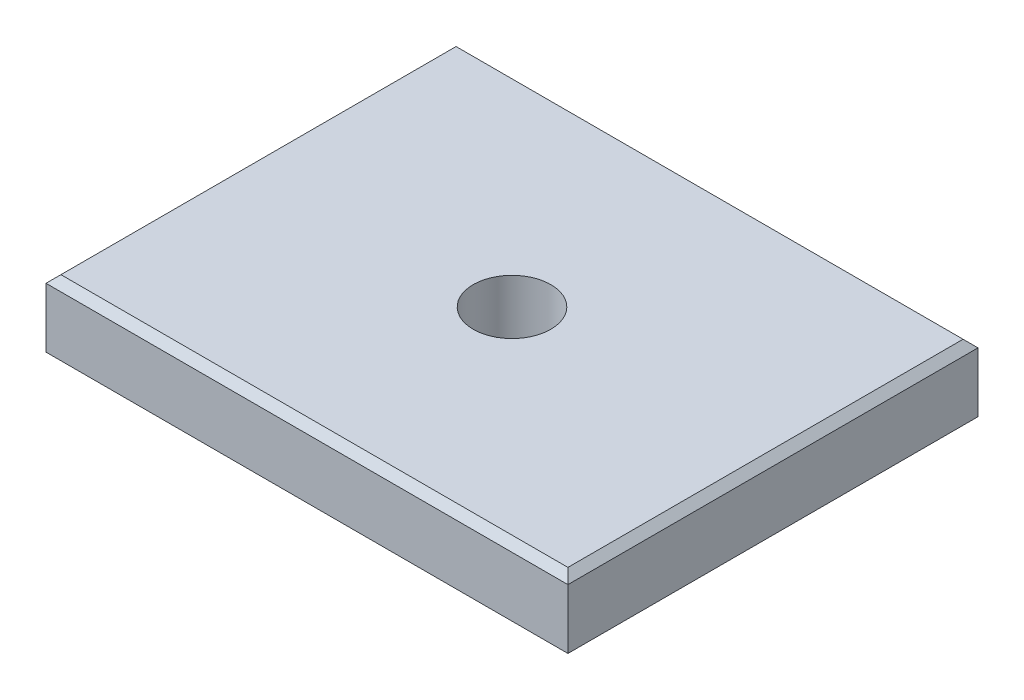
from build123d import *

# Parameters (mm, degrees)
SKETCH1_W           = 70
SKETCH1_H           = 55
BOSS_EXTRUDE1_DEPTH = 10
CHAMFER1_SIZE       = 1
SKETCH2_R           = 5.2
CUT_EXTRUDE1_DEPTH  = 46.620718977


with BuildPart() as part:
    # Sketch1 → Boss-Extrude1 (new body)
    with BuildSketch(Plane(origin=(0, 0, 0), x_dir=(1, 0, 0), z_dir=(0, 1, 0))):
        Rectangle(SKETCH1_W, SKETCH1_H)
    extrude(amount=-BOSS_EXTRUDE1_DEPTH)

    # Chamfer1
    chamfer1_edges = [part.edges().sort_by_distance(p)[0] for p in [
        (0, -10, -27.5),
        (-35, -10, 0),
        (0, -10, 27.5),
        (35, -10, 0),
        (0, 0, 27.5),
        (-35, 0, 0),
        (0, 0, -27.5),
        (35, 0, 0),
    ]]
    chamfer(chamfer1_edges, length=CHAMFER1_SIZE)

    # Sketch2 → Cut-Extrude1 (cut, through all)
    with BuildSketch(Plane(origin=(0, 0, 0), x_dir=(1, 0, 0), z_dir=(0, 1, 0))):
        Circle(SKETCH2_R)
    extrude(amount=-CUT_EXTRUDE1_DEPTH, mode=Mode.SUBTRACT)


solid = part.part
